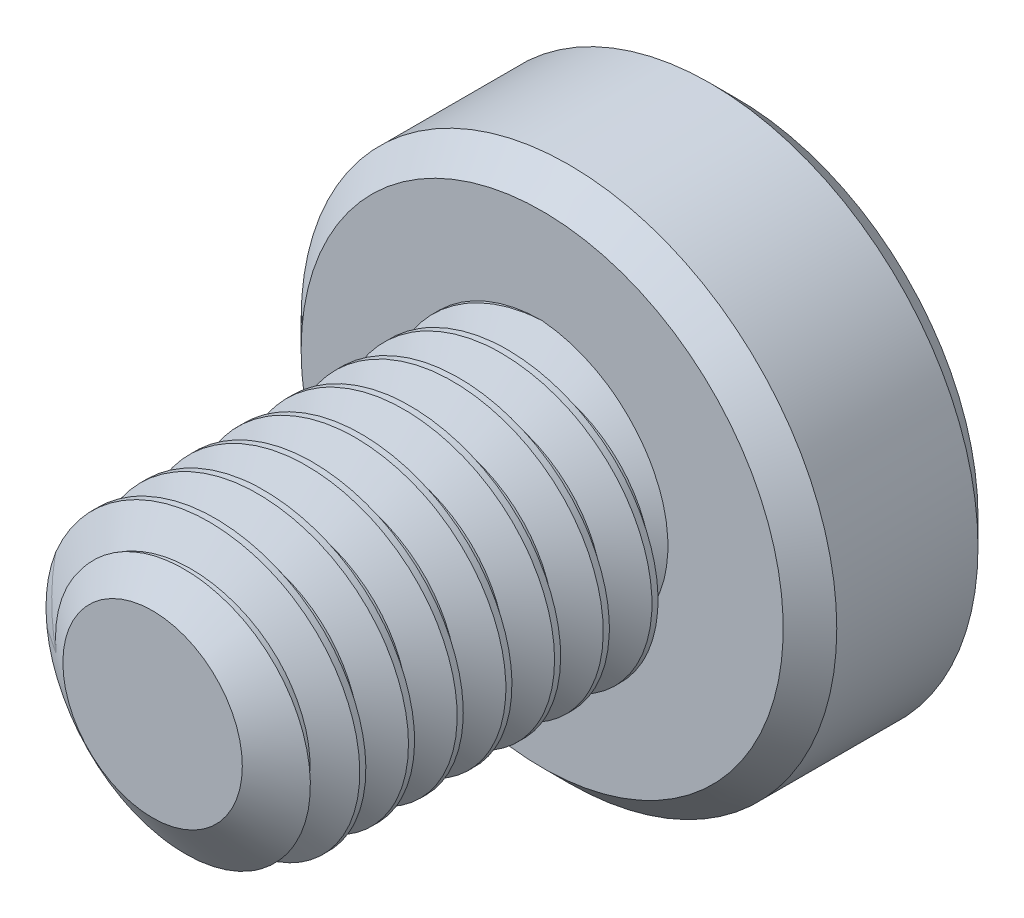
from build123d import *

# Parameters (mm, degrees)
SKETCH1_R          = 1.5
EXTRUDE1_DEPTH     = 4
CUT_SWEEP1_PITCH   = 0.5
SKETCH6_R          = 2.75
EXTRUDE2_DEPTH     = 2
CUT_EXTRUDE1_DEPTH = 1.5
CHAMFER1_SIZE      = 0.275


with BuildPart() as part:
    # Sketch1 → Extrude1 (new body)
    with BuildSketch(Plane.XY):
        Circle(SKETCH1_R)
    extrude(amount=-EXTRUDE1_DEPTH)

    # Cut-Sweep1: the profile of Sketch3 profile screwed along a right-hand helix of 9 turns, 6 arcs to a turn; built about Z, then put on its axis
    cut_sweep1_z = Axis((0, 0, 0), (0, 0, 1))
    cut_sweep1_corners = [(1.5003, 0, -0.437673205), (1.175240474, 0, -0.25), (1.175240474, 0, -0.1875), (1.5003, 0, 0.000173205)]
    with BuildLine(mode=Mode.PRIVATE) as cut_sweep1_profile:
        Line(cut_sweep1_corners[0], cut_sweep1_corners[1])
        Line(cut_sweep1_corners[1], cut_sweep1_corners[2])
        Line(cut_sweep1_corners[2], cut_sweep1_corners[3])
        Line(cut_sweep1_corners[3], cut_sweep1_corners[0])
    cut_sweep1_cap = Face(cut_sweep1_profile.wire())
    cut_sweep1_turn_angles = [0, 30, 60, 90, 120, 150, 180, 210, 240, 270, 300, 330, 360]
    cut_sweep1_turn_weights = [1, 0.8660254037844387, 1, 0.8660254037844387, 1, 0.8660254037844387, 1, 0.8660254037844387, 1, 0.8660254037844387, 1, 0.8660254037844387, 1]
    cut_sweep1_turn_rails = [Edge.make_bspline([Vector(p[0], p[1], 0).rotate(cut_sweep1_z, cut_sweep1_turn_angles[k]) / cut_sweep1_turn_weights[k] + Vector(0, 0, p[2] + CUT_SWEEP1_PITCH * cut_sweep1_turn_angles[k] / 360) for k in range(13)], [0, 0, 0, 1, 1, 2, 2, 3, 3, 4, 4, 5, 5, 6, 6, 6], 2, cut_sweep1_turn_weights) for p in cut_sweep1_corners]
    cut_sweep1_turn_sides = [Face.make_surface_from_curves(cut_sweep1_turn_rails[p[0]], cut_sweep1_turn_rails[p[1]]) for p in [(0, 1), (1, 2), (2, 3), (3, 0)]]
    cut_sweep1 = Plane(origin=(0, 0, 0), x_dir=(0, 1, 0), z_dir=(0, 0, -1)) * Solid(Shell([*[p.moved(Location((0, 0, CUT_SWEEP1_PITCH * i))) for i in range(9) for p in cut_sweep1_turn_sides], cut_sweep1_cap, cut_sweep1_cap.rotate(cut_sweep1_z, 3240).moved(Location((0, 0, CUT_SWEEP1_PITCH * 3240 / 360)))]))
    add(cut_sweep1, mode=Mode.SUBTRACT)

    # Sketch4 → Cut-Revolve1 (revolve, cut)
    with BuildSketch(Plane(origin=(0, 0, 0), x_dir=(0, 0, -1), z_dir=(1, 0, 0)), mode=Mode.PRIVATE) as cut_revolve1_sk:
        Polygon((0.405251783, 1.5), (0, 0.921240474), (0, 1.5), align=None)
    revolve(cut_revolve1_sk.sketch.rotate(Axis((0, 0, 0), (0, 0, -1)), 263.352109169), axis=Axis((0, 0, 0), (0, 0, -1)), mode=Mode.SUBTRACT)

    # Sketch6 → Extrude2 (add)
    with BuildSketch(Plane(origin=(0, 0, -4), x_dir=(-1, 0, 0), z_dir=(0, 0, -1))):
        Circle(SKETCH6_R)
    extrude(amount=EXTRUDE2_DEPTH)

    # Sketch7 → Cut-Extrude1 (cut)
    with BuildSketch(Plane(origin=(0, 0, -6), x_dir=(-1, 0, 0), z_dir=(0, 0, -1))):
        Polygon((0, 1.154700538), (-1, 0.577350269), (-1, -0.577350269), (0, -1.154700538), (1, -0.577350269), (1, 0.577350269), align=None)
    extrude(amount=-CUT_EXTRUDE1_DEPTH, mode=Mode.SUBTRACT)

    # Cut-Extrude2 cone 1 section (through the dimple's axis) → Cut-Extrude2 (revolve, cut)
    with BuildSketch(Plane(origin=(0, 0, -6), x_dir=(0, 1, 0), z_dir=(1, 0, 0))):
        Polygon((0, 0), (1.154700538, 0), (0, 1.154700538), align=None)
    revolve(axis=Axis((0, 0, -6), (0, 0, 1)), mode=Mode.SUBTRACT)

    # Chamfer1
    chamfer1_edges = [part.edges().sort_by_distance(p)[0] for p in [
        (2.75, 0, -4),
        (2.75, 0, -6),
    ]]
    chamfer(chamfer1_edges, length=CHAMFER1_SIZE)


solid = part.part
